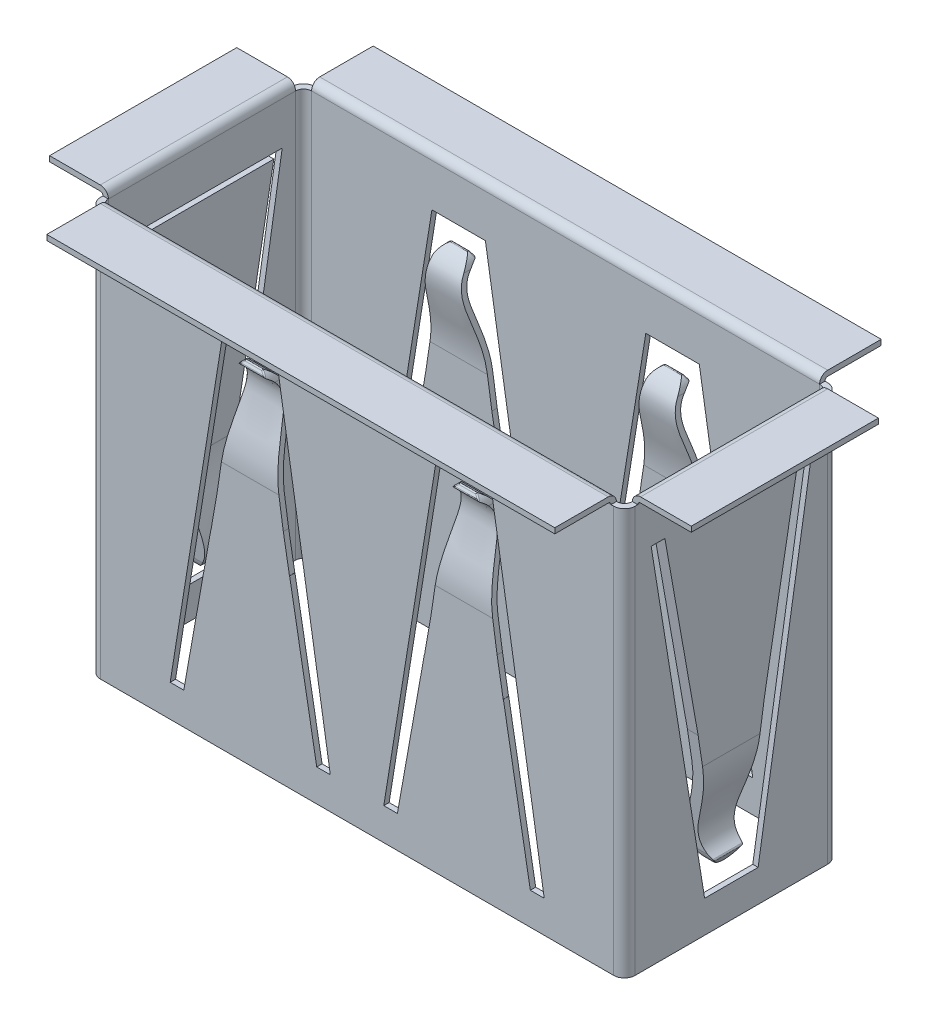
from build123d import *

# Parameters (mm, degrees)
BOSS_EXTRUDE1_DEPTH  = 4.826
CUT_EXTRUDE2_DEPTH   = 12.829421119
CUT_EXTRUDE3_DEPTH   = 10.456171318
BOSS_EXTRUDE2_DEPTH  = 0.127
SKETCH11_W           = 1.574893556
SKETCH11_H           = 0.127
CUT_EXTRUDE8_DEPTH   = 0.889
FILLET3_R            = 0.03175
SKETCH14_W           = 0.414322574
SKETCH14_H           = 1.274166844
CUT_EXTRUDE9_DEPTH   = 0.889
SKETCH15_W           = 0.412892145
SKETCH15_H           = 1.370807769
CUT_EXTRUDE10_DEPTH  = 0.889
FILLET3_OF_MIRROR1_R = 0.03175
SKETCH16_W           = 12.065
SKETCH16_H           = 0.127
SKETCH18_W           = 0.127
SKETCH18_H           = 4.445
CUT_EXTRUDE11_DEPTH  = 16.341884049
BOSS_EXTRUDE3_DEPTH  = 0.254
SKETCH24_W           = 0.254
SKETCH24_H           = 1.574893556
CUT_EXTRUDE12_DEPTH  = 16.341884049
FILLET4_R            = 0.03175
SKETCH30_W           = 0.559065286
SKETCH30_H           = 1.00358527
CUT_EXTRUDE13_DEPTH  = 0.254
SKETCH31_W           = 0.584416549
SKETCH31_H           = 1.08129525
CUT_EXTRUDE14_DEPTH  = 0.127
FILLET4_OF_MIRROR5_R = 0.03175


# Read off the part's stored shape, not the designer's step: Mirror2
with BuildPart() as part:
    # Sketch1 → Boss-Extrude1 (new, symmetric)
    with BuildSketch(Plane(origin=(0, 0, 0), x_dir=(1, 0, 0), z_dir=(0, 1, 0))):
        with BuildLine():
            Line((-6.096522482, 2.54), (6.096522482, 2.54))
            ThreePointArc((6.096522482, 2.54), (6.275758154, 2.465758154), (6.35, 2.286522482))
            Line((6.35, 2.286522482), (6.35, -2.286522482))
            ThreePointArc((6.35, -2.286522482), (6.275758154, -2.465758154), (6.096522482, -2.54))
            Line((6.096522482, -2.54), (-6.096522482, -2.54))
            ThreePointArc((-6.096522482, -2.54), (-6.275758154, -2.465758154), (-6.35, -2.286522482))
            Line((-6.35, -2.286522482), (-6.35, 2.286522482))
            ThreePointArc((-6.35, 2.286522482), (-6.275758154, 2.465758154), (-6.096522482, 2.54))
        make_face()
    extrude(amount=BOSS_EXTRUDE1_DEPTH, both=True)

    # Sketch7 → Cut-Extrude2 (cut, through all)
    with BuildSketch(Plane(origin=(0, 4.826, 0), x_dir=(1, 0, 0), z_dir=(0, 1, 0))):
        with BuildLine():
            Line((6.0325, -2.413), (-6.0325, -2.413))
            ThreePointArc((-6.0325, -2.413), (-6.167203842, -2.357203842), (-6.223, -2.2225))
            Line((-6.223, -2.2225), (-6.223, 2.2225))
            ThreePointArc((-6.223, 2.2225), (-6.167203842, 2.357203842), (-6.0325, 2.413))
            Line((-6.0325, 2.413), (6.0325, 2.413))
            ThreePointArc((6.0325, 2.413), (6.167203842, 2.357203842), (6.223, 2.2225))
            Line((6.223, 2.2225), (6.223, -2.2225))
            ThreePointArc((6.223, -2.2225), (6.167203842, -2.357203842), (6.0325, -2.413))
        make_face()
    extrude(amount=-CUT_EXTRUDE2_DEPTH, mode=Mode.SUBTRACT)

    # Sketch8 → Cut-Extrude3 (cut, through all)
    with BuildSketch(Plane.XY.offset(2.54)):
        Polygon((-3.175, 3.81), (-4.438028061, -4.064), (-0.635, -4.064), (-1.905, 3.81), align=None)
        Polygon((3.175, 3.81), (4.445, -4.064), (0.635, -4.064), (1.905, 3.81), align=None)
    extrude(amount=-CUT_EXTRUDE3_DEPTH, mode=Mode.SUBTRACT)

    # Sketch9 → Boss-Extrude2 (add)
    with BuildSketch(Plane.XY.offset(2.54)):
        Polygon((-4.115560153, -4.064), (-0.957522457, -4.064), (-1.751272457, 0.381), (-3.326166013, 0.381), align=None)
    boss_extrude2 = extrude(amount=-BOSS_EXTRUDE2_DEPTH)

    # Sweep1: sweep along a path in Sketch10
    with BuildLine() as sweep1_path:  # in the path sketch's own coordinates; laid on its plane below (add() does not lay a ready-made edge on the line's plane)
        Line((2.4765, 0.381), (2.4765, 1.079394844))
        add(Edge.make_bspline(
            [(2.4765, 1.079394844), (2.476180189, 1.488687964), (2.240962719, 2.205545329), (1.974444954, 3.042744506), (2.4765, 3.329004381)],
            knots=[0, 0, 0, 0, 0.484569141, 1, 1, 1, 1], degree=3))
    # Sketch11 → Sweep1 (sweep)
    with BuildSketch(Plane(origin=(0, 0.381, 0), x_dir=(1, 0, 0), z_dir=(0, 1, 0))):
        with Locations((-2.538719235, -2.4765)):
            Rectangle(SKETCH11_W, SKETCH11_H)
    sweep1 = sweep(path=Plane.ZY.offset(2.538719235) * sweep1_path.line, transition=Transition.RIGHT)

    # Sketch12 → Cut-Extrude8 (cut)
    with BuildSketch(Plane.XY.offset(2.54)):
        with BuildLine():
            Line((-3.47135167, -0.457510953), (-3.326166013, 0.381))
            Line((-3.326166013, 0.381), (-2.913100935, 3.135012039))
            ThreePointArc((-2.913100935, 3.135012039), (-2.539860025, 3.431249099), (-2.166619115, 3.135012039))
            Line((-2.166619115, 3.135012039), (-1.751272457, 0.381))
            Line((-1.751272457, 0.381), (-1.605287397, -0.457510953))
            Line((-1.605287397, -0.457510953), (-1.216691782, -0.457510953))
            Line((-1.216691782, -0.457510953), (-1.905, 3.81))
            Line((-1.905, 3.81), (-3.175, 3.81))
            Line((-3.175, 3.81), (-3.850103365, -0.398745678))
            Line((-3.850103365, -0.398745678), (-3.47135167, -0.457510953))
        make_face()
    cut_extrude8 = extrude(amount=-CUT_EXTRUDE8_DEPTH, mode=Mode.SUBTRACT)

    # Fillet3
    fillet3_edges = [part.edges().sort_by_distance(p)[0] for p in [
        (-2.793743636, 3.335094033, 2.473034128),
        (-2.285976413, 3.335094033, 2.473034128),
        (-2.539860025, 3.273816649, 2.50790962),
        (-2.539860025, 3.384192113, 2.44509038),
    ]]
    fillet(fillet3_edges, radius=FILLET3_R)

    # Sketch14 → Cut-Extrude9 (cut)
    with BuildSketch(Plane(origin=(-3.691169818, 0.592081668, 0), x_dir=(0, 0, -1), z_dir=(0.9873781877182732, -0.15838028418391797, 0))):
        with Locations((-2.205838713, 2.621970071)):
            Rectangle(SKETCH14_W, SKETCH14_H)
    cut_extrude9 = extrude(amount=-CUT_EXTRUDE9_DEPTH, mode=Mode.SUBTRACT)

    # Sketch15 → Cut-Extrude10 (cut)
    with BuildSketch(Plane(origin=(-1.257763692, -0.202865112, 0), x_dir=(0, 0, 1), z_dir=(-0.9872411207126471, -0.15923243882462032, 0))):
        with Locations((2.206553927, 3.379322582)):
            Rectangle(SKETCH15_W, SKETCH15_H)
    cut_extrude10 = extrude(amount=-CUT_EXTRUDE10_DEPTH, mode=Mode.SUBTRACT)

    # Mirror1: Boss-Extrude2, Sweep1, Cut-Extrude8, Cut-Extrude9, Cut-Extrude10 across plane
    add(boss_extrude2.mirror(Plane(origin=(0, 0, 0), x_dir=(0, 0, 1), z_dir=(1, 0, 0))))
    add(sweep1.mirror(Plane(origin=(0, 0, 0), x_dir=(0, 0, 1), z_dir=(1, 0, 0))))
    add(cut_extrude8.mirror(Plane(origin=(0, 0, 0), x_dir=(0, 0, 1), z_dir=(1, 0, 0))), mode=Mode.SUBTRACT)
    add(cut_extrude9.mirror(Plane(origin=(0, 0, 0), x_dir=(0, 0, 1), z_dir=(1, 0, 0))), mode=Mode.SUBTRACT)
    add(cut_extrude10.mirror(Plane(origin=(0, 0, 0), x_dir=(0, 0, 1), z_dir=(1, 0, 0))), mode=Mode.SUBTRACT)

    # Fillet3 of Mirror1
    fillet3_of_mirror1_edges = [part.edges().sort_by_distance(p)[0] for p in [
        (2.793743636, 3.335094033, 2.473034128),
        (2.285976413, 3.335094033, 2.473034128),
        (2.539860025, 3.273816649, 2.50790962),
        (2.539860025, 3.384192113, 2.44509038),
    ]]
    fillet(fillet3_of_mirror1_edges, radius=FILLET3_OF_MIRROR1_R)

    # Mirror2: part across plane


with BuildPart() as part_1:
    add(part.part)
    add(part.part.mirror(Plane.XY))

    # Sweep2: sweep along a path in Sketch17
    with BuildLine(Plane(origin=(0, 0, 0), x_dir=(0, 0, -1), z_dir=(1, 0, 0))) as sweep2_path:
        Line((-3.875930813, 4.955430813), (-2.605930813, 4.955430813))
        ThreePointArc((-2.605930813, 4.955430813), (-2.514409407, 4.917521406), (-2.4765, 4.826))
    # Sketch16 → Sweep2 (sweep)
    with BuildSketch(Plane(origin=(0, 4.826, 0), x_dir=(1, 0, 0), z_dir=(0, 1, 0))):
        with Locations((0, -2.4765)):
            Rectangle(SKETCH16_W, SKETCH16_H)
    sweep2 = sweep(path=sweep2_path.line)

    # Mirror3: Sweep2 across plane
    add(sweep2.mirror(Plane.XY))

    # Sweep3: sweep along a path in Sketch19
    with BuildLine(Plane.XY) as sweep3_path:
        Line((-7.62, 4.955430813), (-6.415930813, 4.955430813))
        ThreePointArc((-6.415930813, 4.955430813), (-6.324409407, 4.917521406), (-6.2865, 4.826))
    # Sketch18 → Sweep3 (sweep)
    with BuildSketch(Plane(origin=(0, 4.826, 0), x_dir=(1, 0, 0), z_dir=(0, 1, 0))):
        with Locations((-6.2865, 0)):
            Rectangle(SKETCH18_W, SKETCH18_H)
    sweep3 = sweep(path=sweep3_path.line)

    # Mirror4: Sweep3 across plane
    add(sweep3.mirror(Plane(origin=(0, 0, 0), x_dir=(0, 0, 1), z_dir=(1, 0, 0))))

    # Sketch20 → Cut-Extrude11 (cut, through all)
    with BuildSketch(Plane.ZY.offset(6.35)):
        Polygon((1.905, 3.81), (-1.905, 3.81), (-0.635, -4.064), (0.635, -4.064), align=None)
    extrude(amount=-CUT_EXTRUDE11_DEPTH, mode=Mode.SUBTRACT)

    # Sketch22 → Boss-Extrude3 (add)
    with BuildSketch(Plane.ZY.offset(6.35)):
        Polygon((1.579018848, 3.81), (-1.579018848, 3.81), (-0.785268848, -0.635), (0.789624708, -0.635), align=None)
    boss_extrude3 = extrude(amount=-BOSS_EXTRUDE3_DEPTH)

    # Sweep4: sweep along a path in Sketch28
    with BuildLine() as sweep4_path:  # in the path sketch's own coordinates; laid on its plane below (add() does not lay a ready-made edge on the line's plane)
        Line((-6.223, -0.635), (-6.223, -1.333394844))
        add(Edge.make_bspline(
            [(-6.223, -1.333394844), (-6.222680189, -1.742687964), (-5.987462719, -2.459545329), (-5.720944954, -3.296744506), (-6.223, -3.583004381)],
            knots=[0, 0, 0, 0, 0.484569141, 1, 1, 1, 1], degree=3))
    # Sketch24 → Sweep4 (sweep)
    with BuildSketch(Plane(origin=(0, -0.635, 0), x_dir=(-1, 0, 0), z_dir=(0, -1, 0))):
        with Locations((6.223, -0.00217793)):
            Rectangle(SKETCH24_W, SKETCH24_H)
    sweep4 = sweep(path=Plane.XY * sweep4_path.line, transition=Transition.RIGHT)

    # Sketch29 → Cut-Extrude12 (cut, through all)
    with BuildSketch(Plane.ZY.offset(6.35)):
        with BuildLine():
            Line((1.310103365, 0.144745678), (0.928100899, 0.144745678))
            Line((0.928100899, 0.144745678), (0.789624708, -0.635))
            Line((0.789624708, -0.635), (0.373100935, -3.389012039))
            ThreePointArc((0.373100935, -3.389012039), (-0.000139975, -3.685249099), (-0.373380885, -3.389012039))
            Line((-0.373380885, -3.389012039), (-0.785268848, -0.635))
            Line((-0.785268848, -0.635), (-0.935002947, 0.203510953))
            Line((-0.935002947, 0.203510953), (-1.323308218, 0.203510953))
            Line((-1.323308218, 0.203510953), (-0.635, -4.064))
            Line((-0.635, -4.064), (0.635, -4.064))
            Line((0.635, -4.064), (1.310103365, 0.144745678))
        make_face()
    cut_extrude12 = extrude(amount=-CUT_EXTRUDE12_DEPTH, mode=Mode.SUBTRACT)

    # Fillet4
    fillet4_edges = [part_1.edges().sort_by_distance(p)[0] for p in [
        (-6.164808305, -3.685249099, -0.000139975),
        (-6.285819239, -3.472628917, -0.000139975),
    ]]
    fillet(fillet4_edges, radius=FILLET4_R)

    # Sketch30 → Cut-Extrude13 (cut)
    with BuildSketch(Plane(origin=(0, -0.202865112, -1.257763692), x_dir=(1, 0, 0), z_dir=(0, 0.15923243882462557, 0.9872411207126465))):
        with Locations((-5.943467357, -3.176222038)):
            Rectangle(SKETCH30_W, SKETCH30_H)
    cut_extrude13 = extrude(amount=-CUT_EXTRUDE13_DEPTH, mode=Mode.SUBTRACT)

    # Sketch31 → Cut-Extrude14 (cut, symmetric)
    with BuildSketch(Plane(origin=(0, -0.202865112, 1.257763692), x_dir=(-1, 0, 0), z_dir=(0, 0.15923243882462532, -0.9872411207126464))):
        with Locations((5.930791726, -3.126781743)):
            Rectangle(SKETCH31_W, SKETCH31_H)
    cut_extrude14 = extrude(amount=CUT_EXTRUDE14_DEPTH, both=True, mode=Mode.SUBTRACT)

    # Mirror5: Boss-Extrude3, Sweep4, Cut-Extrude12, Cut-Extrude13, Cut-Extrude14 across plane
    add(boss_extrude3.mirror(Plane(origin=(0, 0, 0), x_dir=(0, 0, 1), z_dir=(1, 0, 0))))
    add(sweep4.mirror(Plane(origin=(0, 0, 0), x_dir=(0, 0, 1), z_dir=(1, 0, 0))))
    add(cut_extrude12.mirror(Plane(origin=(0, 0, 0), x_dir=(0, 0, 1), z_dir=(1, 0, 0))), mode=Mode.SUBTRACT)
    add(cut_extrude13.mirror(Plane(origin=(0, 0, 0), x_dir=(0, 0, 1), z_dir=(1, 0, 0))), mode=Mode.SUBTRACT)
    add(cut_extrude14.mirror(Plane(origin=(0, 0, 0), x_dir=(0, 0, 1), z_dir=(1, 0, 0))), mode=Mode.SUBTRACT)

    # Fillet4 of Mirror5
    fillet4_of_mirror5_edges = [part_1.edges().sort_by_distance(p)[0] for p in [
        (6.164808305, -3.685249099, -0.000139975),
        (6.285819239, -3.472628917, -0.000139975),
    ]]
    fillet(fillet4_of_mirror5_edges, radius=FILLET4_OF_MIRROR5_R)


solid = part_1.part
